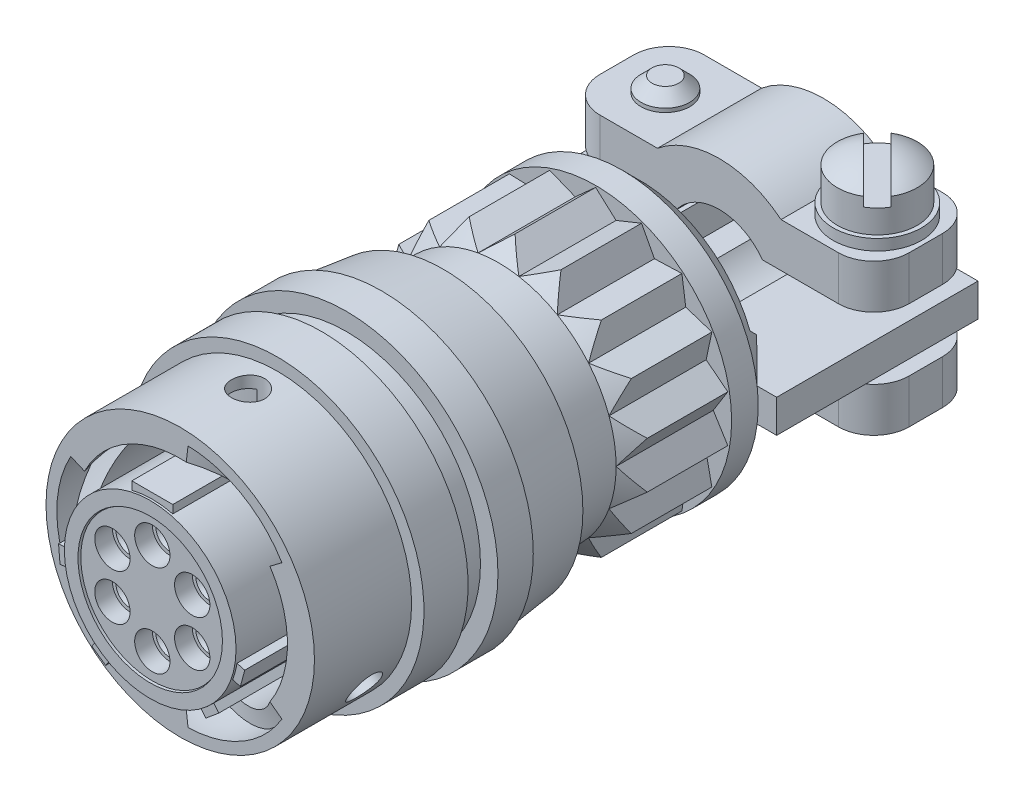
from build123d import *

# Parameters (mm, degrees)
SKETCH3_W                = 21.082
SKETCH3_H                = 5.1435
BOSS_EXTRUDE1_START      = -9.2202
BOSS_EXTRUDE1_DEPTH      = 9.0678
SKETCH6_R                = 1.1938
CUT_EXTRUDE1_DEPTH       = 28.705526646
CUT_SWEEP1_PITCH         = 19.5072
CIRPATTERN1_COUNT        = 3
BOSS_EXTRUDE2_DEPTH      = 6.985
CIRPATTERN2_COUNT        = 18
BOSS_EXTRUDE3_DEPTH      = 13.208
BOSS_EXTRUDE3_DEPTH_BACK = 1.27
SKETCH12_W               = 7.2771
SKETCH12_H               = 2.3749
CHAMFER1_SIZE            = 1.905
CUT_EXTRUDE2_DEPTH       = 1.18745
CUT_EXTRUDE2_DEPTH_BACK  = 1.18745
SKETCH13_R               = 1.7526
BOSS_EXTRUDE4_DEPTH      = 7.493
SKETCH15_R               = 1.7526
CUT_EXTRUDE3_DEPTH       = 51.855294399
SKETCH16_W               = 1.2954
SKETCH16_H               = 0.7874
CUT_EXTRUDE4_START       = -1.6764
CUT_EXTRUDE4_DEPTH       = 51.862431792
CIRPATTERN3_COUNT        = 2
SKETCH10_6S_R            = 1.27
CUT_EXTRUDE10_6S_DEPTH   = 7.7978
EXTRUDE_THIN10_6S_START  = -1.27
SKETCH10_6S_6_R          = 1.27
SKETCH10_6S_6_R_2        = 0.635
EXTRUDE_THIN10_6S_DEPTH  = 22.86
CHAMFER10_6S_SIZE        = 0.381


with BuildPart() as part:
    # Sketch3 → Revolve1 (revolve)
    with BuildSketch(Plane(origin=(0, 0, 0), x_dir=(0, 0, -1), z_dir=(1, 0, 0)), mode=Mode.PRIVATE) as revolve1_sk:
        Polygon((9.7282, 6.7437), (9.7282, 6.35), (13.8684, 6.35), (14.66215, 7.14375), (20.44065, 7.14375), (21.2344, 6.35), (23.0124, 6.35), (23.0124, 6.3119), (21.2344, 6.3119), (21.2344, 5.1943), (0, 5.1943), (0, 6.1722), (9.2202, 6.1722), (9.2202, 6.7437), align=None)
        with Locations((10.6934, 2.57175)):
            Rectangle(SKETCH3_W, SKETCH3_H)
    revolve(revolve1_sk.sketch.rotate(Axis((0, 0, 0), (0, 0, -1)), 90), axis=Axis((0, 0, 0), (0, 0, -1)))

    # Sketch4 → Boss-Extrude1 (add)
    with BuildSketch(Plane.XY.offset(BOSS_EXTRUDE1_START)):
        with BuildLine():
            Line((-1.4732, 6.580818448), (1.4732, 6.580818448))
            Line((1.4732, 6.580818448), (1.4732, 5.993808022))
            ThreePointArc((1.4732, 5.993808022), (0, 6.1722), (-1.4732, 5.993808022))
            Line((-1.4732, 5.993808022), (-1.4732, 6.580818448))
        make_face()
        with BuildLine():
            Line((6.645021782, -1.149423861), (6.329469602, -2.327080628))
            Line((6.329469602, -2.327080628), (5.774962091, -2.178500788))
            ThreePointArc((5.774962091, -2.178500788), (5.961887385, -1.59748291), (6.090514271, -1.000844021))
            Line((6.090514271, -1.000844021), (6.645021782, -1.149423861))
        make_face()
        with BuildLine():
            Line((4.784000735, -4.752980818), (3.85003935, -5.536667472))
            Line((3.85003935, -5.536667472), (3.481035284, -5.096905551))
            ThreePointArc((3.481035284, -5.096905551), (3.967413685, -4.728179512), (4.414996669, -4.313218897))
            Line((4.414996669, -4.313218897), (4.784000735, -4.752980818))
        make_face()
        with BuildLine():
            Line((-3.352836422, -5.85115182), (-4.351546594, -5.151847428))
            Line((-4.351546594, -5.151847428), (-4.022274477, -4.681598111))
            ThreePointArc((-4.022274477, -4.681598111), (-3.54022848, -5.055970248), (-3.023564305, -5.380902502))
            Line((-3.023564305, -5.380902502), (-3.352836422, -5.85115182))
        make_face()
        with BuildLine():
            Line((-6.637404047, -1.192626182), (-6.743664328, 0.021934394))
            Line((-6.743664328, 0.021934394), (-6.171780414, 0.071967753))
            ThreePointArc((-6.171780414, 0.071967753), (-6.148712916, -0.537942675), (-6.065520133, -1.142592823))
            Line((-6.065520133, -1.142592823), (-6.637404047, -1.192626182))
        make_face()
    extrude(amount=BOSS_EXTRUDE1_DEPTH)

    # Sketch10-6S → Cut-Extrude10-6S (cut)
    with BuildSketch(Plane.XY.offset(-0.1524)):
        with Locations((0, 3.302)):
            Circle(SKETCH10_6S_R)
        with Locations((2.8702, 1.651)):
            Circle(SKETCH10_6S_R)
        with Locations((2.8702, -1.651)):
            Circle(SKETCH10_6S_R)
        with Locations((0, -3.302)):
            Circle(SKETCH10_6S_R)
        with Locations((-2.8702, -1.651)):
            Circle(SKETCH10_6S_R)
        with Locations((-2.8702, 1.651)):
            Circle(SKETCH10_6S_R)
    extrude(amount=-CUT_EXTRUDE10_6S_DEPTH, mode=Mode.SUBTRACT)

    # Sketch10-6S<6> → Extrude-Thin10-6S (add)
    # profile 1 of 6: a face of its own
    with BuildSketch(Plane.XY.offset(-0.1524).offset(EXTRUDE_THIN10_6S_START)):
        with Locations((0, 3.302)):
            Circle(SKETCH10_6S_6_R)
        with Locations((0, 3.302)):
            Circle(SKETCH10_6S_6_R_2, mode=Mode.SUBTRACT)
    # profile 2 of 6: a face of its own
    with BuildSketch(Plane.XY.offset(-0.1524).offset(EXTRUDE_THIN10_6S_START)):
        with Locations((2.8702, 1.651)):
            Circle(SKETCH10_6S_6_R)
        with Locations((2.8702, 1.651)):
            Circle(SKETCH10_6S_6_R_2, mode=Mode.SUBTRACT)
    # profile 3 of 6: a face of its own
    with BuildSketch(Plane.XY.offset(-0.1524).offset(EXTRUDE_THIN10_6S_START)):
        with Locations((2.8702, -1.651)):
            Circle(SKETCH10_6S_6_R)
        with Locations((2.8702, -1.651)):
            Circle(SKETCH10_6S_6_R_2, mode=Mode.SUBTRACT)
    # profile 4 of 6: a face of its own
    with BuildSketch(Plane.XY.offset(-0.1524).offset(EXTRUDE_THIN10_6S_START)):
        with Locations((0, -3.302)):
            Circle(SKETCH10_6S_6_R)
        with Locations((0, -3.302)):
            Circle(SKETCH10_6S_6_R_2, mode=Mode.SUBTRACT)
    # profile 5 of 6: a face of its own
    with BuildSketch(Plane.XY.offset(-0.1524).offset(EXTRUDE_THIN10_6S_START)):
        with Locations((-2.8702, -1.651)):
            Circle(SKETCH10_6S_6_R)
        with Locations((-2.8702, -1.651)):
            Circle(SKETCH10_6S_6_R_2, mode=Mode.SUBTRACT)
    # profile 6 of 6: a face of its own
    with BuildSketch(Plane.XY.offset(-0.1524).offset(EXTRUDE_THIN10_6S_START)):
        with Locations((-2.8702, 1.651)):
            Circle(SKETCH10_6S_6_R)
        with Locations((-2.8702, 1.651)):
            Circle(SKETCH10_6S_6_R_2, mode=Mode.SUBTRACT)
    extrude(amount=-EXTRUDE_THIN10_6S_DEPTH)

    # Chamfer10-6S
    chamfer10_6s_edges = [part.edges().sort_by_distance(p)[0] for p in [
        (2.2352, -1.651, -1.4224),
        (-0.635, 3.302, -1.4224),
        (2.2352, 1.651, -1.4224),
        (-0.635, -3.302, -1.4224),
        (-3.5052, -1.651, -1.4224),
        (-3.5052, 1.651, -1.4224),
    ]]
    chamfer(chamfer10_6s_edges, length=CHAMFER10_6S_SIZE)


with BuildPart() as body_2:
    # Sketch5 → Revolve2 (revolve)
    with BuildSketch(Plane(origin=(0, 0, 0), x_dir=(0, 0, -1), z_dir=(1, 0, 0)), mode=Mode.PRIVATE) as revolve2_sk:
        Polygon((2.159, 9.652), (2.159, 7.7089), (17.272, 7.7089), (17.272, 9.5885), (21.082, 9.5885), (21.082, 10.033), (16.637, 10.578777373), (16.637, 10.9093), (14.097, 10.9093), (14.097, 9.652), (12.319, 9.652), (12.319, 10.541), (9.144, 10.541), (9.144, 9.652), align=None)
    revolve(revolve2_sk.sketch.rotate(Axis((0, 0, -23.0124), (0, 0, 1)), 90), axis=Axis((0, 0, -23.0124), (0, 0, 1)))

    # Sketch6 → Cut-Extrude1 (cut, through all)
    with BuildSketch(Plane(origin=(0, 0, 0), x_dir=(1, 0, 0), z_dir=(0, 1, 0))):
        with Locations(Location((0, 7.0358, 0), (0, 0, 90))):
            Circle(SKETCH6_R)
    cut_extrude1 = extrude(amount=CUT_EXTRUDE1_DEPTH, mode=Mode.SUBTRACT)

    # Cut-Sweep1: arcs per turn and ends read off the stored shape
    # Cut-Sweep1: the profile of Sketch8 screwed along a right-hand helix through 1.25 turns, 20 arcs to a turn; built about Z, then put on its axis
    cut_sweep1_z = Axis((0, 0, 0), (0, 0, 1))
    cut_sweep1_corners = [(7.590446941, 0.502912226, -20.755932851), (8.770179735, 0.502912226, -20.755932851), (8.770179735, -0.502912226, -18.258467149), (7.590446941, -0.502912226, -18.258467149)]
    with BuildLine(mode=Mode.PRIVATE) as cut_sweep1_profile:
        Line(cut_sweep1_corners[0], cut_sweep1_corners[1])
        Line(cut_sweep1_corners[2], cut_sweep1_corners[3])
        ThreePointArc((8.770179735, 0.502912226, -20.755932851), (8.87289733, 0, -19.5072), (8.770179735, -0.502912226, -18.258467149))
        ThreePointArc((7.590446941, -0.502912226, -18.258467149), (7.7089, 0, -19.5072), (7.590446941, 0.502912226, -20.755932851))
    cut_sweep1_cap = Face(cut_sweep1_profile.wire())
    cut_sweep1_arcs = [((8.770179735, 0.502912226, -20.755932851), (8.976817967, 0, -19.5072), (8.770179735, -0.502912226, -18.258467149), (1, 0.9884234437826221, 1)), ((7.590446941, -0.502912226, -18.258467149), (7.829201583, 0, -19.5072), (7.590446941, 0.502912226, -20.755932851), (1, 0.9846342463109203, 1))]  # start, shoulder, end, weights
    cut_sweep1_turn_angles = [0, 9, 18, 27, 36, 45, 54, 63, 72, 81, 90, 99, 108, 117, 126, 135, 144, 153, 162, 171, 180, 189, 198, 207, 216, 225, 234, 243, 252, 261, 270, 279, 288, 297, 306, 315, 324, 333, 342, 351, 360]
    cut_sweep1_turn_weights = [1, 0.9876883405951378, 1, 0.9876883405951378, 1, 0.9876883405951378, 1, 0.9876883405951378, 1, 0.9876883405951378, 1, 0.9876883405951378, 1, 0.9876883405951378, 1, 0.9876883405951378, 1, 0.9876883405951378, 1, 0.9876883405951378, 1, 0.9876883405951378, 1, 0.9876883405951378, 1, 0.9876883405951378, 1, 0.9876883405951378, 1, 0.9876883405951378, 1, 0.9876883405951378, 1, 0.9876883405951378, 1, 0.9876883405951378, 1, 0.9876883405951378, 1, 0.9876883405951378, 1]
    cut_sweep1_turn_rails = [Edge.make_bspline([Vector(p[0], p[1], 0).rotate(cut_sweep1_z, cut_sweep1_turn_angles[k]) / cut_sweep1_turn_weights[k] + Vector(0, 0, p[2] + CUT_SWEEP1_PITCH * cut_sweep1_turn_angles[k] / 360) for k in range(41)], [0, 0, 0, 1, 1, 2, 2, 3, 3, 4, 4, 5, 5, 6, 6, 7, 7, 8, 8, 9, 9, 10, 10, 11, 11, 12, 12, 13, 13, 14, 14, 15, 15, 16, 16, 17, 17, 18, 18, 19, 19, 20, 20, 20], 2, cut_sweep1_turn_weights) for p in cut_sweep1_corners]
    cut_sweep1_turn_sides = [*[Face.make_surface_from_curves(cut_sweep1_turn_rails[p[0]], cut_sweep1_turn_rails[p[1]]) for p in [(0, 1), (2, 3)]], *[Face.make_bezier_surface([[Vector(p[j][0], p[j][1], 0).rotate(cut_sweep1_z, cut_sweep1_turn_angles[2 * i + k]) / cut_sweep1_turn_weights[2 * i + k] + Vector(0, 0, p[j][2] + CUT_SWEEP1_PITCH * cut_sweep1_turn_angles[2 * i + k] / 360) for k in range(3)] for j in range(3)], [[p[3][j] * cut_sweep1_turn_weights[2 * i + k] for k in range(3)] for j in range(3)]) for p in cut_sweep1_arcs for i in range(20)]]
    cut_sweep1_last_angles = [360, 369, 378, 387, 396, 405, 414, 423, 432, 441, 450]
    cut_sweep1_last_weights = [1, 0.9876883405951378, 1, 0.9876883405951378, 1, 0.9876883405951378, 1, 0.9876883405951378, 1, 0.9876883405951378, 1]
    cut_sweep1_last_rails = [Edge.make_bspline([Vector(p[0], p[1], 0).rotate(cut_sweep1_z, cut_sweep1_last_angles[k]) / cut_sweep1_last_weights[k] + Vector(0, 0, p[2] + CUT_SWEEP1_PITCH * cut_sweep1_last_angles[k] / 360) for k in range(11)], [0, 0, 0, 1, 1, 2, 2, 3, 3, 4, 4, 5, 5, 5], 2, cut_sweep1_last_weights) for p in cut_sweep1_corners]
    cut_sweep1_last_sides = [*[Face.make_surface_from_curves(cut_sweep1_last_rails[p[0]], cut_sweep1_last_rails[p[1]]) for p in [(0, 1), (2, 3)]], *[Face.make_bezier_surface([[Vector(p[j][0], p[j][1], 0).rotate(cut_sweep1_z, cut_sweep1_last_angles[2 * i + k]) / cut_sweep1_last_weights[2 * i + k] + Vector(0, 0, p[j][2] + CUT_SWEEP1_PITCH * cut_sweep1_last_angles[2 * i + k] / 360) for k in range(3)] for j in range(3)], [[p[3][j] * cut_sweep1_last_weights[2 * i + k] for k in range(3)] for j in range(3)]) for p in cut_sweep1_arcs for i in range(5)]]
    cut_sweep1 = Plane(origin=(0, 0, -2.159), x_dir=(-1, 0, 0), z_dir=(0, 0, -1)) * Solid(Shell([*cut_sweep1_turn_sides, *cut_sweep1_last_sides, cut_sweep1_cap, cut_sweep1_cap.rotate(cut_sweep1_z, 450).moved(Location((0, 0, CUT_SWEEP1_PITCH * 450 / 360)))]))
    add(cut_sweep1, mode=Mode.SUBTRACT)

    # CirPattern1: Cut-Extrude1, Cut-Sweep1 ×3 about axis
    cirpattern1_axis = Axis((0, 0, -23.0124), (0, 0, -1))
    add([cut_extrude1.rotate(cirpattern1_axis, i * 360 / CIRPATTERN1_COUNT) for i in range(1, CIRPATTERN1_COUNT)], mode=Mode.SUBTRACT)
    add([cut_sweep1.rotate(cirpattern1_axis, i * 360 / CIRPATTERN1_COUNT) for i in range(1, CIRPATTERN1_COUNT)], mode=Mode.SUBTRACT)


with BuildPart() as body_3:
    # Sketch9 → Revolve3 (revolve)
    with BuildSketch(Plane(origin=(0, 0, 0), x_dir=(0, 0, -1), z_dir=(1, 0, 0)), mode=Mode.PRIVATE) as revolve3_sk:
        Polygon((18.3134, 8.4582), (18.3134, 7.14375), (32.0294, 7.14375), (32.0294, 3.8354), (35.2044, 3.8354), (35.2044, 8.509), (33.9344, 9.779), (32.0294, 9.779), (32.0294, 8.4582), align=None)
    revolve(revolve3_sk.sketch.rotate(Axis((0, 0, 0), (0, 0, -1)), 90), axis=Axis((0, 0, 0), (0, 0, -1)))

    # Sketch10 → Boss-Extrude2 (add)
    with BuildSketch(Plane.XY.offset(-32.0294)):
        with BuildLine():
            Line((-1.468751016, 8.329700937), (0, 9.652))
            Line((0, 9.652), (1.468751016, 8.329700937))
            ThreePointArc((1.468751016, 8.329700937), (0, 8.4582), (-1.468751016, 8.329700937))
        make_face()
    boss_extrude2 = extrude(amount=BOSS_EXTRUDE2_DEPTH)

    # CirPattern2: Boss-Extrude2 ×18 about axis
    cirpattern2_axis = Axis((0, 0, 0), (0, 0, 1))
    for i in range(1, CIRPATTERN2_COUNT):
        add(boss_extrude2.rotate(cirpattern2_axis, i * 360 / CIRPATTERN2_COUNT))

    # Sketch11 → Cut-Revolve1 (revolve, cut)
    with BuildSketch(Plane(origin=(0, 0, 0), x_dir=(0, 0, -1), z_dir=(1, 0, 0)), mode=Mode.PRIVATE) as cut_revolve1_sk:
        Polygon((25.0444, 9.652), (25.0444, 8.4582), (26.2382, 9.652), align=None)
    revolve(cut_revolve1_sk.sketch.rotate(Axis((0, 0, -32.0294), (0, 0, 1)), 90), axis=Axis((0, 0, -32.0294), (0, 0, 1)), mode=Mode.SUBTRACT)

    # Sketch12 → Boss-Extrude3 (add, two sides: drawn at the far end of the back side and taken through both)
    with BuildSketch(Plane(origin=(0, 0, -35.2044), x_dir=(-1, 0, 0), z_dir=(0, 0, -1)).offset(-BOSS_EXTRUDE3_DEPTH_BACK)):
        with Locations((-7.47395, 0)):
            Rectangle(SKETCH12_W, SKETCH12_H)
        with Locations((7.47395, 0)):
            Rectangle(SKETCH12_W, SKETCH12_H)
    extrude(amount=BOSS_EXTRUDE3_DEPTH + BOSS_EXTRUDE3_DEPTH_BACK)

    # Chamfer1
    chamfer1_edges = [body_3.edges().sort_by_distance(p)[0] for p in [
        (6.130568485, 1.18745, -35.2044),
        (6.130568485, -1.18745, -35.2044),
        (-6.130568485, -1.18745, -35.2044),
        (-6.130568485, 1.18745, -35.2044),
    ]]
    chamfer(chamfer1_edges, length=CHAMFER1_SIZE)

    # Sketch13 → Cut-Extrude2 (cut, two sides: drawn at the far end of the back side and taken through both)
    with BuildSketch(Plane(origin=(0, 0, 0), x_dir=(1, 0, 0), z_dir=(0, 1, 0)).offset(-CUT_EXTRUDE2_DEPTH_BACK)):
        with Locations(Location((7.62, 44.6659, 0), (0, 0, 90))):
            Circle(SKETCH13_R)
        with Locations((-7.62, 44.6659)):
            Circle(SKETCH13_R)
    extrude(amount=CUT_EXTRUDE2_DEPTH + CUT_EXTRUDE2_DEPTH_BACK, mode=Mode.SUBTRACT)


with BuildPart() as body_4:
    # Sketch14 → Boss-Extrude4 (new body)
    with BuildSketch(Plane(origin=(0, 0, -48.4124), x_dir=(-1, 0, 0), z_dir=(0, 0, -1))):
        with BuildLine():
            Line((-11.1125, 2.2479), (-11.1125, 5.4229))
            Line((-11.1125, 5.4229), (-4.442731564, 5.4229))
            ThreePointArc((-4.442731564, 5.4229), (0, 7.0104), (4.442731564, 5.4229))
            Line((4.442731564, 5.4229), (11.1125, 5.4229))
            Line((11.1125, 5.4229), (11.1125, 2.2479))
            Line((11.1125, 2.2479), (3.107609813, 2.2479))
            ThreePointArc((3.107609813, 2.2479), (0, 3.8354), (-3.107609813, 2.2479))
            Line((-3.107609813, 2.2479), (-11.1125, 2.2479))
        make_face()
    extrude(amount=-BOSS_EXTRUDE4_DEPTH)

    # Sketch15 → Cut-Extrude3 (cut, through all)
    with BuildSketch(Plane(origin=(0, 0, 0), x_dir=(1, 0, 0), z_dir=(0, 1, 0))):
        with Locations(Location((-7.62, 44.6659, 0), (0, 0, 90))):
            Circle(SKETCH15_R)
        with Locations(Location((7.62, 44.6659, 0), (0, 0, 90))):
            Circle(SKETCH15_R)
        with BuildLine():
            Line((8.5725, 48.4124), (11.1125, 48.4124))
            Line((11.1125, 48.4124), (11.1125, 45.8724))
            ThreePointArc((11.1125, 45.8724), (10.368551224, 47.668451224), (8.5725, 48.4124))
        make_face()
        with BuildLine():
            Line((11.1125, 40.9194), (8.5725, 40.9194))
            ThreePointArc((8.5725, 40.9194), (10.368551224, 41.663348776), (11.1125, 43.4594))
            Line((11.1125, 43.4594), (11.1125, 40.9194))
        make_face()
        with BuildLine():
            Line((-11.1125, 48.4124), (-8.5725, 48.4124))
            ThreePointArc((-8.5725, 48.4124), (-10.368551224, 47.668451224), (-11.1125, 45.8724))
            Line((-11.1125, 45.8724), (-11.1125, 48.4124))
        make_face()
        with BuildLine():
            Line((-8.5725, 40.9194), (-11.1125, 40.9194))
            Line((-11.1125, 40.9194), (-11.1125, 43.4594))
            ThreePointArc((-11.1125, 43.4594), (-10.368551224, 41.663348776), (-8.5725, 40.9194))
        make_face()
    extrude(amount=CUT_EXTRUDE3_DEPTH, mode=Mode.SUBTRACT)


with BuildPart() as body_5:
    # Sketch16 → Revolve4 (revolve)
    with BuildSketch(Plane.XY.offset(-44.6659), mode=Mode.PRIVATE) as revolve4_sk:
        with Locations((5.0927, 5.8166)):
            Rectangle(SKETCH16_W, SKETCH16_H)
    revolve(revolve4_sk.sketch.rotate(Axis((7.62, 0, -44.6659), (0, 1, 0)), 270), axis=Axis((7.62, 0, -44.6659), (0, 1, 0)))


with BuildPart() as body_6:
    # Sketch17 → Revolve5 (revolve)
    with BuildSketch(Plane.XY.offset(-44.6659), mode=Mode.PRIVATE) as revolve5_sk:
        with BuildLine():
            Line((7.62, 9.5631), (7.62, -6.4897))
            Line((7.62, -6.4897), (6.66115, -6.4897))
            Line((6.66115, -6.4897), (5.8674, -5.69595))
            Line((5.8674, -5.69595), (5.8674, 6.2103))
            Line((5.8674, 6.2103), (4.7498, 6.2103))
            Line((4.7498, 6.2103), (4.7498, 8.55726))
            ThreePointArc((4.7498, 8.55726), (6.099328919, 9.304360105), (7.62, 9.5631))
        make_face()
    revolve(revolve5_sk.sketch.rotate(Axis((7.62, 6.2103, -44.6659), (0, -1, 0)), 270), axis=Axis((7.62, 6.2103, -44.6659), (0, -1, 0)))

    # Sketch18 → Cut-Extrude4 (cut, through all)
    with BuildSketch(Plane.XZ.offset(-6.2103).offset(CUT_EXTRUDE4_START)):
        Polygon((5.09935436, -46.204330127), (6.081569873, -47.18654564), (10.14064564, -43.127469873), (9.158430127, -42.14525436), align=None)
    extrude(amount=-CUT_EXTRUDE4_DEPTH, mode=Mode.SUBTRACT)


with BuildPart() as cirpattern3_1:
    # CirPattern3: pattern copy
    add(body_4.part.rotate(Axis((0, 0, 0), (0, 0, 1)), 1 * 360 / CIRPATTERN3_COUNT))


with BuildPart() as cirpattern3_2:
    # CirPattern3: pattern copy
    add(body_6.part.rotate(Axis((0, 0, 0), (0, 0, 1)), 1 * 360 / CIRPATTERN3_COUNT))


with BuildPart() as cirpattern3_3:
    # CirPattern3: pattern copy
    add(body_5.part.rotate(Axis((0, 0, 0), (0, 0, 1)), 1 * 360 / CIRPATTERN3_COUNT))


solid = Compound([part.part, body_2.part, body_3.part, body_4.part, body_5.part, body_6.part, cirpattern3_1.part, cirpattern3_2.part, cirpattern3_3.part])
